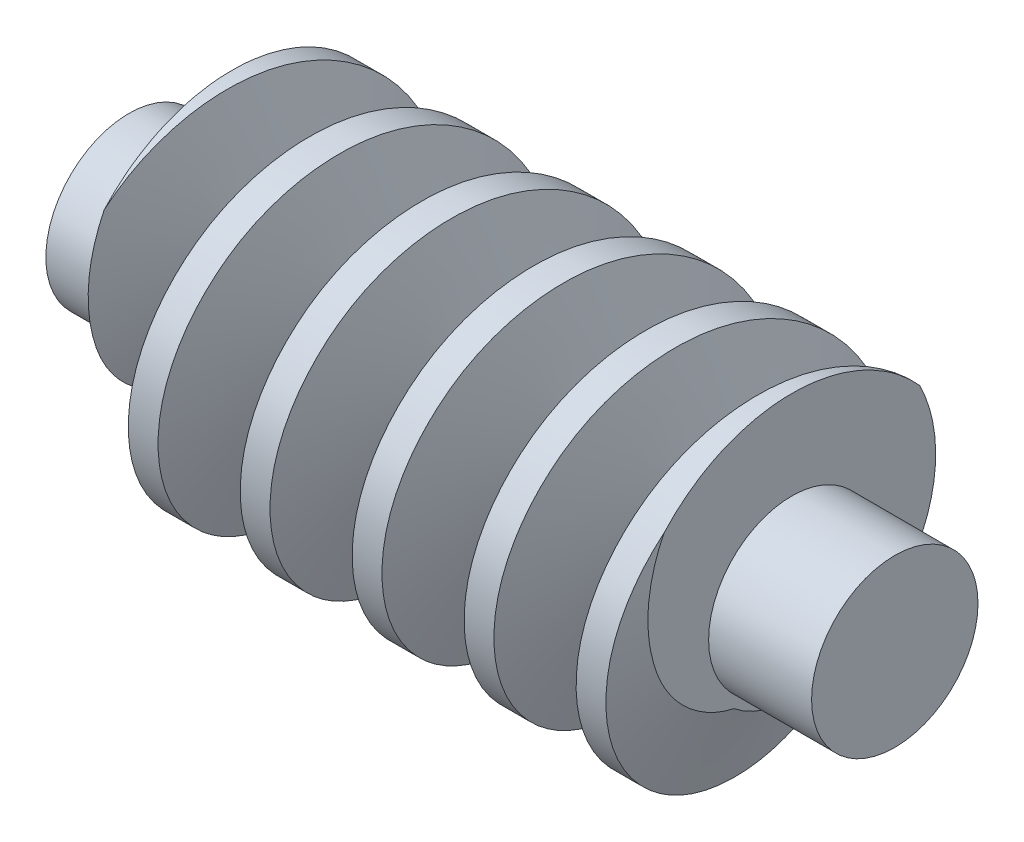
from build123d import *

# Parameters (mm, degrees)
ESQUISSE1_W        = 7.92050331
ESQUISSE1_H        = 1.308007774
BALAYAGE3_PITCH    = 1.584100662
ESQUISSE2_R        = 1.177206996
BOSS_EXTRU_1_DEPTH = 1.45712066


with BuildPart() as part:
    # Esquisse1 → Révolution1 (revolve)
    with BuildSketch(Plane.XY, mode=Mode.PRIVATE) as r_volution1_sk:
        with Locations((0, 0.654003887)):
            Rectangle(ESQUISSE1_W, ESQUISSE1_H)
    revolve(r_volution1_sk.sketch.rotate(Axis((-39.34140866, 0, 0), (1, 0, 0)), 90), axis=Axis((-39.34140866, 0, 0), (1, 0, 0)))

    # Balayage3: the profile of Esquisse5<2> profile screwed along a left-hand helix of 6.5 turns, 8 arcs to a turn; built about Z, then put on its axis
    balayage3_z = Axis((0, 0, 0), (0, 0, 1))
    balayage3_corners = [(2.433007774, 0, 0.210713965), (1.307707774, 0, 0.620289669), (1.307707774, 0, -0.620289669), (2.433007774, 0, -0.210713965)]
    with BuildLine(mode=Mode.PRIVATE) as balayage3_profile:
        Line(balayage3_corners[0], balayage3_corners[1])
        Line(balayage3_corners[1], balayage3_corners[2])
        Line(balayage3_corners[2], balayage3_corners[3])
        Line(balayage3_corners[3], balayage3_corners[0])
    balayage3_cap = Face(balayage3_profile.wire())
    balayage3_turn_angles = [0, -22.5, -45, -67.5, -90, -112.5, -135, -157.5, -180, -202.5, -225, -247.5, -270, -292.5, -315, -337.5, -360]
    balayage3_turn_weights = [1, 0.9238795325112867, 1, 0.9238795325112867, 1, 0.9238795325112867, 1, 0.9238795325112867, 1, 0.9238795325112867, 1, 0.9238795325112867, 1, 0.9238795325112867, 1, 0.9238795325112867, 1]
    balayage3_turn_rails = [Edge.make_bspline([Vector(p[0], p[1], 0).rotate(balayage3_z, balayage3_turn_angles[k]) / balayage3_turn_weights[k] + Vector(0, 0, p[2] + -BALAYAGE3_PITCH * balayage3_turn_angles[k] / 360) for k in range(17)], [0, 0, 0, 1, 1, 2, 2, 3, 3, 4, 4, 5, 5, 6, 6, 7, 7, 8, 8, 8], 2, balayage3_turn_weights) for p in balayage3_corners]
    balayage3_turn_sides = [Face.make_surface_from_curves(balayage3_turn_rails[p[0]], balayage3_turn_rails[p[1]]) for p in [(0, 1), (1, 2), (2, 3), (3, 0)]]
    balayage3_last_angles = [-2160, -2182.5, -2205, -2227.5, -2250, -2272.5, -2295, -2317.5, -2340]
    balayage3_last_weights = [1, 0.9238795325112867, 1, 0.9238795325112867, 1, 0.9238795325112867, 1, 0.9238795325112503, 1]
    balayage3_last_rails = [Edge.make_bspline([Vector(p[0], p[1], 0).rotate(balayage3_z, balayage3_last_angles[k]) / balayage3_last_weights[k] + Vector(0, 0, p[2] + -BALAYAGE3_PITCH * balayage3_last_angles[k] / 360) for k in range(9)], [0, 0, 0, 1, 1, 2, 2, 3, 3, 4, 4, 4], 2, balayage3_last_weights) for p in balayage3_corners]
    balayage3_last_sides = [Face.make_surface_from_curves(balayage3_last_rails[p[0]], balayage3_last_rails[p[1]]) for p in [(0, 1), (1, 2), (2, 3), (3, 0)]]
    balayage3 = Plane(origin=(5.544352318, 0, 0), x_dir=(0, 1, 0), z_dir=(-1, 0, 0)) * Solid(Shell([*[p.moved(Location((0, 0, BALAYAGE3_PITCH * i))) for i in range(6) for p in balayage3_turn_sides], *balayage3_last_sides, balayage3_cap, balayage3_cap.rotate(balayage3_z, -2340).moved(Location((0, 0, -BALAYAGE3_PITCH * -2340 / 360)))]))
    add(balayage3)

    # Enlèv. mat.-Surface1
    split(bisect_by=Plane(origin=(3.960251655, 0, 0), x_dir=(0, 0, -1), z_dir=(1, 0, 0)), keep=Keep.BOTTOM)

    # Enlèv. mat.-Surface2
    split(bisect_by=Plane.ZY.offset(3.960251655), keep=Keep.BOTTOM)

    # Esquisse2 → Boss.-Extru.1 (add)
    with BuildSketch(Plane(origin=(3.960251655, 0, 0), x_dir=(0, 0, -1), z_dir=(1, 0, 0))):
        with Locations(Location((0, 0, 0), (0, 0, 180))):
            Circle(ESQUISSE2_R)
    boss_extru_1 = extrude(amount=BOSS_EXTRU_1_DEPTH)

    # Symétrie1: Boss.-Extru.1 across plane
    add(boss_extru_1.mirror(Plane(origin=(0, 0, 0), x_dir=(0, 0, 1), z_dir=(1, 0, 0))))


solid = part.part
